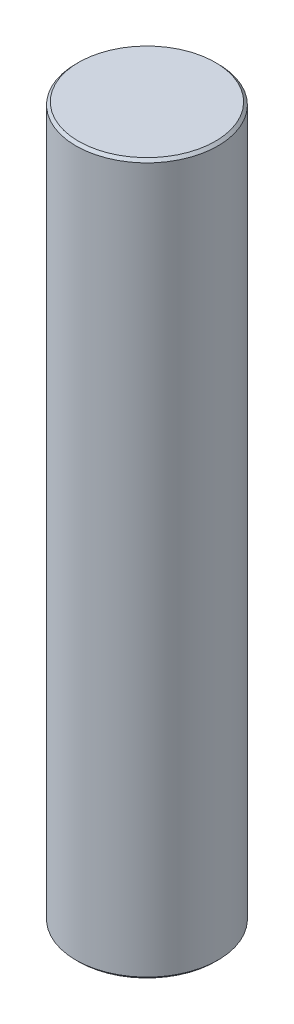
from build123d import *

# Parameters (mm, degrees)
SKETCH1_R           = 4
BOSS_EXTRUDE1_DEPTH = 40
CHAMFER1_SIZE       = 0.15


with BuildPart() as part:
    # Sketch1 → Boss-Extrude1 (new body)
    with BuildSketch(Plane(origin=(0, 0, 0), x_dir=(1, 0, 0), z_dir=(0, 1, 0))):
        Circle(SKETCH1_R)
    extrude(amount=BOSS_EXTRUDE1_DEPTH)

    # Chamfer1
    chamfer1_edges = [part.edges().sort_by_distance(p)[0] for p in [
        (-4, 0, 0),
        (-4, 40, 0),
    ]]
    chamfer(chamfer1_edges, length=CHAMFER1_SIZE)


solid = part.part
